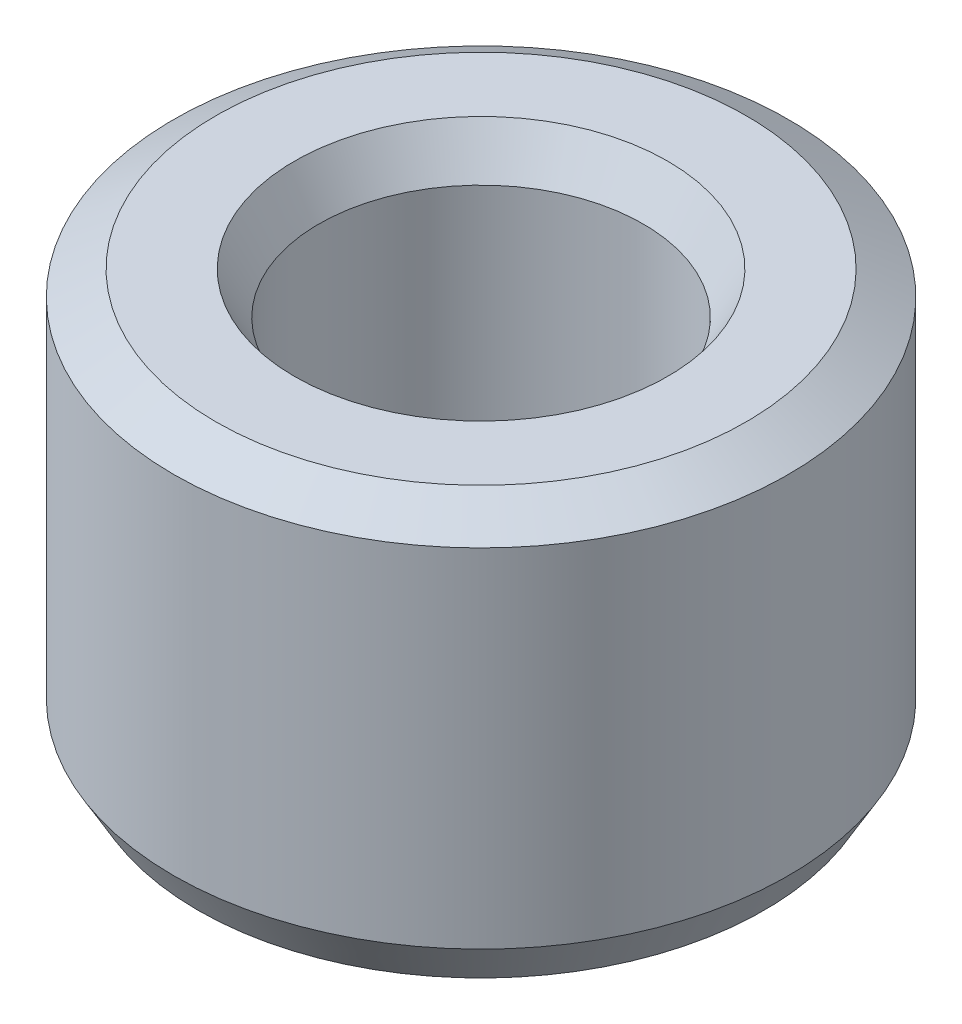
from build123d import *
from OCP.BRepFilletAPI import BRepFilletAPI_MakeChamfer

# Parameters (mm, degrees)
SKETCH1_R           = 5
BOSS_EXTRUDE1_DEPTH = 6.734572061
SKETCH2_R           = 2.637706566
CUT_EXTRUDE1_DEPTH  = 10.764960873
CHAMFER1_SIZE       = 0.396620897
CHAMFER1_SIZE2      = 0.686967545


with BuildPart() as part:
    # Sketch1 → Boss-Extrude1 (new body)
    with BuildSketch(Plane(origin=(0, 0, 0), x_dir=(1, 0, 0), z_dir=(0, 1, 0))):
        Circle(SKETCH1_R)
    extrude(amount=BOSS_EXTRUDE1_DEPTH)

    # Sketch2 → Cut-Extrude1 (cut, through all)
    with BuildSketch(Plane(origin=(0, 0, 0), x_dir=(1, 0, 0), z_dir=(0, 1, 0))):
        Circle(SKETCH2_R)
    extrude(amount=CUT_EXTRUDE1_DEPTH, mode=Mode.SUBTRACT)

    # Chamfer1: one chamfer whose edges measure the first distance from different faces: ONE call of the kernel's chamfer builder (chamfer() names one face for all edges)
    chamfer1_edges_1 = [part.edges().sort_by_distance(p)[0] for p in [
        (-2.637706566, 6.734572061, 0),
    ]]
    chamfer1_side_1 = [part.faces().sort_by_distance(p)[0] for p in [
        (-4.858578644, 6.734572061, 0),
    ]]
    chamfer1_edges_2 = [part.edges().sort_by_distance(p)[0] for p in [
        (-2.637706566, 0, 0),
    ]]
    chamfer1_side_2 = [part.faces().sort_by_distance(p)[0] for p in [
        (-2.637706566, 3.367286031, 0),
    ]]
    chamfer1_edges_3 = [part.edges().sort_by_distance(p)[0] for p in [
        (-5, 0, 0),
    ]]
    chamfer1_side_3 = [part.faces().sort_by_distance(p)[0] for p in [
        (-4.858578644, 0, 0),
    ]]
    chamfer1_edges_4 = [part.edges().sort_by_distance(p)[0] for p in [
        (-5, 6.734572061, 0),
    ]]
    chamfer1_side_4 = [part.faces().sort_by_distance(p)[0] for p in [
        (-5, 3.367286031, 0),
    ]]
    chamfer1 = BRepFilletAPI_MakeChamfer(part.part.solid().wrapped)
    for e in chamfer1_edges_1:
        chamfer1.Add(CHAMFER1_SIZE, CHAMFER1_SIZE2, e.wrapped, chamfer1_side_1[0].wrapped)  # the first distance lies on this face
    for e in chamfer1_edges_2:
        chamfer1.Add(CHAMFER1_SIZE, CHAMFER1_SIZE2, e.wrapped, chamfer1_side_2[0].wrapped)  # the first distance lies on this face
    for e in chamfer1_edges_3:
        chamfer1.Add(CHAMFER1_SIZE, CHAMFER1_SIZE2, e.wrapped, chamfer1_side_3[0].wrapped)  # the first distance lies on this face
    for e in chamfer1_edges_4:
        chamfer1.Add(CHAMFER1_SIZE, CHAMFER1_SIZE2, e.wrapped, chamfer1_side_4[0].wrapped)  # the first distance lies on this face
    add(Compound.cast(chamfer1.Shape()), mode=Mode.REPLACE)


solid = part.part
